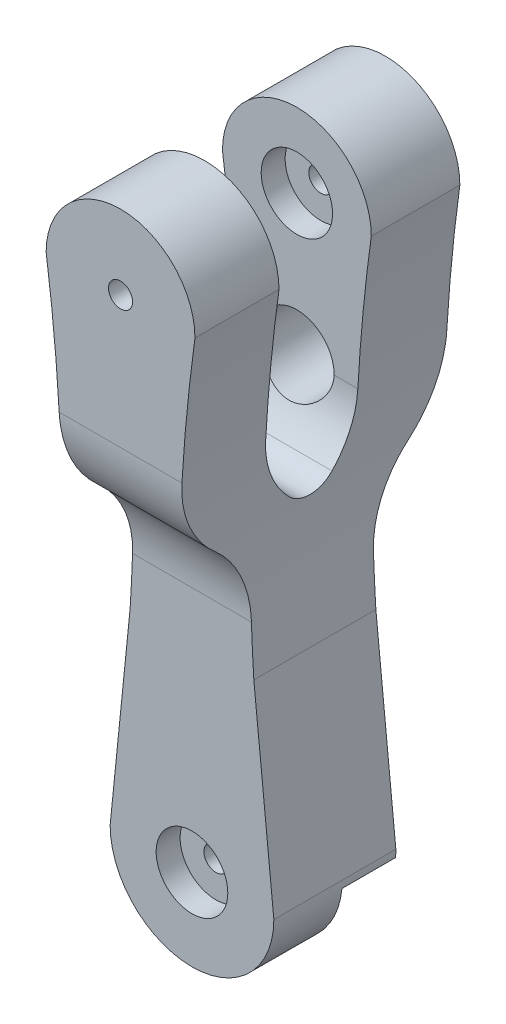
from build123d import *

# Parameters (mm, degrees)
SALIENTE_EXTRUIR1_DEPTH      = 44.5
SALIENTE_EXTRUIR1_DEPTH_BACK = 44.5
CORTAR_EXTRUIR1_START        = -24
CORTAR_EXTRUIR1_DEPTH        = 24
CORTAR_EXTRUIR2_DEPTH        = 24
REDONDEO1_R                  = 35
REDONDEO3_R                  = 35
CORTAR_EXTRUIR3_DEPTH        = 58.5
CROQUIS5_R                   = 12.500000000000016
CORTAR_EXTRUIR4_DEPTH        = 48.5
REDONDEO8_R                  = 30
REDONDEO9_R                  = 10
CORTAR_EXTRUIR5_DEPTH        = 43.05
CORTAR_EXTRUIR5_DEPTH_BACK   = 8.05
CROQUIS6_R                   = 12.000000000000016
CORTAR_EXTRUIR6_DEPTH        = 88.04999999999998
CORTAR_EXTRUIR6_DEPTH_BACK   = 28.049999999999997
CROQUIS7_R                   = 4.050000000000006
CROQUIS10_R                  = 27.5
CORTAR_EXTRUIR9_DEPTH        = 18
CORTAR_EXTRUIR14_DEPTH       = 35
CORTAR_EXTRUIR21_DEPTH       = 25
REDONDEO19_R                 = 3
CORTAR_EXTRUIR31_DEPTH       = 15
CORTAR_EXTRUIR31_DEPTH_BACK  = 4.999999999999999
CROQUIS33_R                  = 4.05
CORTAR_EXTRUIR32_DEPTH       = 35
CROQUIS34_R                  = 12.035
CORTAR_EXTRUIR33_DEPTH       = 8.05
CORTAR_EXTRUIR34_DEPTH       = 15
CORTAR_EXTRUIR34_DEPTH_BACK  = 5


with BuildPart() as part:
    # Croquis1 → Saliente-Extruir1 (new, two sides: drawn at the far end of the back side and taken through both)
    with BuildSketch(Plane.XY.offset(-SALIENTE_EXTRUIR1_DEPTH_BACK)):
        with BuildLine():
            Line((27.5, 0), (20.783701773198683, 66.38093729609668))
            ThreePointArc((20.783701773198683, 66.38093729609668), (20.024433339693815, 123.29687585851822), (25.000000000000014, 180))
            ThreePointArc((25.000000000000014, 180), (1.444e-14, 205), (-24.999999999999986, 180))
            ThreePointArc((-24.999999999999986, 180), (-20.0244333396937, 123.29687585851815), (-20.78370177319863, 66.38093729609668))
            Line((-20.78370177319863, 66.38093729609668), (-27.5, 0))
            ThreePointArc((-27.5, 0), (-5.05e-15, -27.5), (27.5, 0))
        make_face()
    extrude(amount=SALIENTE_EXTRUIR1_DEPTH + SALIENTE_EXTRUIR1_DEPTH_BACK)

    # Croquis2 → Cortar-Extruir1 (cut)
    with BuildSketch(Plane.XY.offset(44.5).offset(CORTAR_EXTRUIR1_START)):
        with BuildLine():
            Line((-27.5, -1.9203e-13), (-20.783701773198548, 66.3809372960967))
            ThreePointArc((-20.783701773198548, 66.3809372960967), (-19.923071613909883, 84.36144663092024), (-19.636097648887073, 102.36025342898752))
            Line((-19.636097648887073, 102.36025342898752), (19.636097648887297, 102.36025342898373))
            ThreePointArc((19.636097648887297, 102.36025342898373), (19.9230716139067, 84.36144663091831), (20.783701773198683, 66.38093729609668))
            Line((20.783701773198683, 66.38093729609668), (27.5, 0))
            ThreePointArc((27.5, 0), (9.938e-14, -27.499999999999986), (-27.5, -1.9203e-13))
        make_face()
    extrude(amount=CORTAR_EXTRUIR1_DEPTH, mode=Mode.SUBTRACT)

    # Croquis3 → Cortar-Extruir2 (cut)
    with BuildSketch(Plane(origin=(0, 0, -44.5), x_dir=(-1, 0, 0), z_dir=(0, 0, -1))):
        with BuildLine():
            Line((-27.5, 0), (-20.783701773198683, 66.38093729609668))
            ThreePointArc((-20.783701773198683, 66.38093729609668), (-19.923071613914544, 84.36144663091848), (-19.636097648887297, 102.36025342898373))
            Line((-19.636097648887297, 102.36025342898373), (19.636097648887073, 102.36025342898358))
            ThreePointArc((19.636097648887073, 102.36025342898358), (19.92307161390545, 84.36144663091817), (20.783701773198548, 66.3809372960967))
            Line((20.783701773198548, 66.3809372960967), (27.5, 0))
            ThreePointArc((27.5, 0), (1.68e-15, -27.499999999999996), (-27.5, 0))
        make_face()
    extrude(amount=-CORTAR_EXTRUIR2_DEPTH, mode=Mode.SUBTRACT)

    # Redondeo1
    # the kernel refuses this fillet: 35 mm, written as the material it takes off along each edge
    with BuildSketch(Plane(origin=(102.70233627806806, 102.36025342898402, -44.5), x_dir=(-3.62e-15, 1, 0), z_dir=(-1, -3.62e-15, 0))) as redondeo1_piece_1:
        with BuildLine():
            CenterArc((33.22649545167231, -35), REDONDEO1_R, 90, 71.68230158880155)
            Line((1.421e-14, -24), (-0.6645299090334333, -23.78))
            ThreePointArc((-0.6645299090334333, -23.78), (-0.7000000000000028, -12), (-0.7000000000000028, 0))
            Line((-0.7000000000000028, 0), (0, 0.7000000000000028))
            Line((0, 0.7000000000000028), (33.22649545167231, 0.7000000000000028))
            Line((33.22649545167231, 0.7000000000000028), (33.22649545167231, 0))
        make_face()
    extrude(amount=205.4046725561359, mode=Mode.SUBTRACT)
    with BuildSketch(Plane(origin=(-102.7023362780678, 102.36025342899555, 44.5), x_dir=(0, 0, -1), z_dir=(1, -9.662e-14, 0))) as redondeo1_piece_2:
        with BuildLine():
            CenterArc((35, 33.22649545167229), REDONDEO1_R, 180, 71.68230158880152)
            Line((0, 33.22649545167229), (-0.7000000000000028, 33.22649545167229))
            Line((-0.7000000000000028, 33.22649545167229), (-0.7000000000000028, 0))
            Line((-0.7000000000000028, 0), (0, -0.7000000000000028))
            ThreePointArc((0, -0.7000000000000028), (12, -0.7000000000000028), (23.78, -0.6645299090334476))
            Line((23.78, -0.6645299090334476), (24, 0))
        make_face()
    extrude(amount=205.40467255613584, mode=Mode.SUBTRACT)

    # Redondeo3
    redondeo3_edges = [part.edges().sort_by_distance(p)[0] for p in [
        (1.1369e-13, 102.36025342898563, 20.5),
        (1.1013e-13, 102.36025342898365, -20.5),
    ]]
    fillet(redondeo3_edges, radius=REDONDEO3_R)

    # Croquis3D2 → Cortar-Extruir3 (cut)
    with BuildSketch(Plane(origin=(-24.999999999999105, 121.83181469642778, -14.739893982780725), x_dir=(-2.150015976069332e-12, 0.970486714162273, 0.24115459281240073), z_dir=(-1.0, 0, -8.914949664428034e-12))):
        with BuildLine():
            Line((0, 0), (121.09710255773136, 30.091213029412213))
            Line((121.09710255773136, 30.091213029412213), (128.5573844091173, -3.47e-15))
            Line((128.5573844091173, -3.47e-15), (7.6467007003513885, -30.044890126730003))
            ThreePointArc((7.6467007003513885, -30.044890126730003), (-2.3764738724496546, -25.575940038707603), (-10.455030098348384, -18.148122545589356))
            ThreePointArc((-10.455030098348384, -18.148122545589356), (-6.687251525667822, -8.233115397591352), (0, 0))
        make_face()
    extrude(amount=-CORTAR_EXTRUIR3_DEPTH, mode=Mode.SUBTRACT)

    # Croquis5 → Cortar-Extruir4 (cut)
    with BuildSketch(Plane(origin=(0, 0, -44.5), x_dir=(-1, 0, 0), z_dir=(0, 0, -1))):
        with Locations(Location((-1.01308e-12, 133.57263188887632, 0), (0, 0, 9.272454345))):
            Circle(CROQUIS5_R)
    extrude(amount=-CORTAR_EXTRUIR4_DEPTH, mode=Mode.SUBTRACT)

    # Redondeo8
    # the kernel refuses this fillet: 30 mm, written as the material it adds along each edge
    with BuildSketch(Plane(origin=(-74.1309499335336, 122.00737288868928, 16.26230970698953), x_dir=(-1.4e-16, 1, -2.41e-15), z_dir=(1.0, 0, 8.914949664428034e-12))) as redondeo8_piece_1_section:
        with BuildLine():
            CenterArc((11.78730191984913, -30), REDONDEO8_R, 90.00000000000004, 61.98943792286214)
            Line((-14.698529101666413, -15.910970398933602), (-15.228245722096721, -15.629189806912274))
            ThreePointArc((-15.228245722096721, -15.629189806912274), (-9.090373471764734, -6.34705155262911), (-0.288148981094737, 0.5262795499485684))
            Line((-0.288148981094737, 0.5262795499485684), (-1.45e-15, 0.6000000000000014))
            Line((-1.45e-15, 0.6000000000000014), (11.787301919849112, 0.6000000000000014))
            Line((11.787301919849112, 0.6000000000000014), (11.787301919849114, 0))
        make_face()
    redondeo8_piece_1 = extrude(amount=148.26189986706723, mode=Mode.PRIVATE)
    redondeo8_piece_1 = redondeo8_piece_1 - Plane(origin=(-584.2158848617112, 102.36025342898773, 12.086878930976017), x_dir=(0.9904993014758943, 0.13751775803788244, 0), z_dir=(0, 0, -1)) * Cylinder(564.579787212824, 361, mode=Mode.PRIVATE)
    redondeo8_piece_1 = redondeo8_piece_1 - Plane(origin=(584.2158848617221, 102.36025342898745, 12.086878930976017), x_dir=(-0.9979673304813536, -0.06372760227657126, 0), z_dir=(0, 0, -1)) * Cylinder(564.5797872128348, 361, mode=Mode.PRIVATE)
    add(redondeo8_piece_1)
    with BuildSketch(Plane(origin=(-72.33261967734306, 121.83181469642777, -14.739893983202698), x_dir=(-6.42350550029948e-12, -0.6934105693594783, 0.7205426998454458), z_dir=(1.0, 0, 8.914949664428034e-12))) as redondeo8_piece_2_section:
        with BuildLine():
            CenterArc((13.634950866610524, -29.095944858396155), REDONDEO8_R, 75.89830986699852, 60.20099506763049)
            Line((-7.9813301287528535, -8.293627777611805), (-8.413655748660121, -7.8775814359961185))
            Line((-8.413655748660121, -7.8775814359961185), (-0.43232561990726726, 0.41604634161568677))
            Line((-0.43232561990726726, 0.41604634161568677), (-0.18817326017112648, 0.5697287285687529))
            ThreePointArc((-0.18817326017112648, 0.5697287285687529), (10.47212975338705, 2.2846425572884943), (21.090445679577403, 0.581918897167919))
            Line((21.090445679577403, 0.581918897167919), (20.944259506774134, -3.7e-16))
        make_face()
    redondeo8_piece_2 = extrude(amount=120.40337198241693, mode=Mode.PRIVATE)
    redondeo8_piece_2 = redondeo8_piece_2 - Plane(origin=(-584.2158848617112, 102.36025342898773, -10.345911675917899), x_dir=(0.9904993014758943, 0.13751775803788244, 0), z_dir=(0, 0, -1)) * Cylinder(564.579787212824, 326, mode=Mode.PRIVATE)
    redondeo8_piece_2 = redondeo8_piece_2 - Plane(origin=(1.01308e-12, 133.57263188887632, -10.345911675917897), x_dir=(-0.9869332953933623, 0.16112935934831482, 0), z_dir=(0, 0, -1)) * Cylinder(12.500000000000016, 326, mode=Mode.PRIVATE)
    redondeo8_piece_2 = redondeo8_piece_2 - Plane(origin=(584.2158848617221, 102.36025342898745, -10.345911675917899), x_dir=(-0.9979673304813536, -0.06372760227657126, 0), z_dir=(0, 0, -1)) * Cylinder(564.5797872128348, 326, mode=Mode.PRIVATE)
    add(redondeo8_piece_2)
    with BuildSketch(Plane(origin=(-48.07075230507185, 121.83181469642778, -14.739893982986406), x_dir=(-6.423505500299477e-12, -0.6934105693594786, 0.7205426998454454), z_dir=(1.0, 0, 8.914949664428034e-12))) as redondeo8_piece_3_section:
        with BuildLine():
            CenterArc((13.634950866610517, -29.095944858396148), REDONDEO8_R, 75.89830986699847, 60.2009950676305)
            Line((-7.9813301287528455, -8.29362777761179), (-8.413655748660112, -7.877581435996103))
            Line((-8.413655748660112, -7.877581435996103), (-0.432325619907267, 0.41604634161568693))
            Line((-0.432325619907267, 0.41604634161568693), (-0.18817326017112612, 0.569728728568753))
            ThreePointArc((-0.18817326017112612, 0.569728728568753), (10.472129753387057, 2.284642557288501), (21.090445679577414, 0.5819188971679177))
            Line((21.090445679577414, 0.5819188971679177), (20.944259506774145, -1.85e-15))
        make_face()
    redondeo8_piece_3 = extrude(amount=120.40337198241494, mode=Mode.PRIVATE)
    redondeo8_piece_3 = redondeo8_piece_3 - Plane(origin=(-584.2158848617112, 102.36025342898773, -10.345911675910257), x_dir=(0.9904993014758943, 0.13751775803788244, 0), z_dir=(0, 0, -1)) * Cylinder(564.579787212824, 326, mode=Mode.PRIVATE)
    redondeo8_piece_3 = redondeo8_piece_3 - Plane(origin=(1.01308e-12, 133.57263188887632, -10.345911675910259), x_dir=(-0.9869332953933623, 0.16112935934831482, 0), z_dir=(0, 0, -1)) * Cylinder(12.500000000000016, 326, mode=Mode.PRIVATE)
    redondeo8_piece_3 = redondeo8_piece_3 - Plane(origin=(584.2158848617221, 102.36025342898745, -10.345911675910257), x_dir=(-0.9979673304813536, -0.06372760227657126, 0), z_dir=(0, 0, -1)) * Cylinder(564.5797872128348, 326, mode=Mode.PRIVATE)
    add(redondeo8_piece_3)

    # Redondeo9
    redondeo9_edges = [part.edges().sort_by_distance(p)[0] for p in [
        (1.066e-14, 107.30884378702285, 0.3513393087168235),
    ]]
    fillet(redondeo9_edges, radius=REDONDEO9_R)

    # Croquis6 → Cortar-Extruir5 (cut, two sides: drawn at the far end of the back side and taken through both)
    with BuildSketch(Plane.XY.offset(-14.73989398278073).offset(-CORTAR_EXTRUIR5_DEPTH_BACK)):
        with Locations(Location((1.01308e-12, 180, 0), (0, 0, 180))):
            Circle(CROQUIS6_R)
    extrude(amount=CORTAR_EXTRUIR5_DEPTH + CORTAR_EXTRUIR5_DEPTH_BACK, mode=Mode.SUBTRACT)

    # Croquis7 → Cortar-Extruir6 (cut, two sides: drawn at the far end of the back side and taken through both)
    with BuildSketch(Plane.XY.offset(-22.78989398278073).offset(-CORTAR_EXTRUIR6_DEPTH_BACK)):
        with Locations((1.01308e-12, 180)):
            Circle(CROQUIS7_R)
    extrude(amount=CORTAR_EXTRUIR6_DEPTH + CORTAR_EXTRUIR6_DEPTH_BACK, mode=Mode.SUBTRACT)

    # Croquis10 → Cortar-Extruir9 (cut)
    with BuildSketch(Plane(origin=(0, 0, -20.499999999999996), x_dir=(-1, 0, 0), z_dir=(0, 0, -1))):
        with Locations((0, -5.041436867208791)):
            Circle(CROQUIS10_R)
    extrude(amount=-CORTAR_EXTRUIR9_DEPTH, mode=Mode.SUBTRACT)

    # Croquis12 → Cortar-Extruir14 (cut)
    with BuildSketch(Plane(origin=(25.000000000000135, 179.99999999999997, -44.5), x_dir=(1, 0, 0), z_dir=(0, 0, 1))):
        Polygon((-20.000000000000146, -95.04143686720876), (-30.000000000000146, -95.04143686720876), (-30.00000000000014, -164.05714355557723), (-20.000000000000135, -164.05714355557723), align=None)
    extrude(amount=CORTAR_EXTRUIR14_DEPTH, mode=Mode.SUBTRACT)

    # Croquis20 → Cortar-Extruir21 (cut)
    with BuildSketch(Plane(origin=(0, 0, -44.5), x_dir=(-1, 0, 0), z_dir=(0, 0, -1))):
        Polygon((-9.999999999999998, 39.456606796679445), (-6.999999999999997, 39.456606796679445), (-6.999999999999997, 29.45660679667944), (-9.999999999999996, 29.45660679667944), align=None)
        Polygon((7.000000000000003, 39.456606796679445), (7.000000000000004, 29.45660679667944), (10.000000000000004, 29.45660679667944), (10.000000000000004, 39.456606796679445), align=None)
        Polygon((-10.000000000000068, 59.45660679667944), (-10.000000000000066, 49.456606796679445), (-7.000000000000066, 49.456606796679445), (-7.000000000000066, 59.45660679667944), align=None)
        Polygon((6.999999999999934, 59.45660679667944), (6.999999999999936, 49.456606796679445), (9.999999999999934, 49.456606796679445), (9.999999999999934, 59.45660679667944), align=None)
        Polygon((-10.000000000000135, 79.45660679667944), (-10.000000000000133, 69.45660679667945), (-7.000000000000135, 69.45660679667945), (-7.000000000000135, 79.45660679667944), align=None)
        Polygon((6.999999999999866, 79.45660679667944), (6.999999999999868, 69.45660679667945), (9.999999999999867, 69.45660679667945), (9.999999999999867, 79.45660679667944), align=None)
    extrude(amount=-CORTAR_EXTRUIR21_DEPTH, mode=Mode.SUBTRACT)

    # Redondeo19
    redondeo19_edges = [part.edges().sort_by_distance(p)[0] for p in [
        (-1.066e-14, 84.95856313279121, -9.5),
    ]]
    fillet(redondeo19_edges, radius=REDONDEO19_R)

    # Croquis32 → Cortar-Extruir31 (cut, two sides: drawn at the far end of the back side and taken through both)
    with BuildSketch(Plane.ZY.offset(-5).offset(-CORTAR_EXTRUIR31_DEPTH_BACK)):
        Polygon((-18.499999999999996, 39.456606796679445), (-15.499999999999995, 39.456606796679445), (-15.499999999999993, 29.45660679667944), (-18.499999999999993, 29.45660679667944), align=None)
        Polygon((-18.500000000000064, 59.45660679667944), (-18.50000000000006, 49.456606796679445), (-15.500000000000062, 49.456606796679445), (-15.500000000000064, 59.45660679667944), align=None)
        Polygon((-18.500000000000135, 79.45660679667944), (-18.50000000000013, 69.45660679667945), (-15.50000000000013, 69.45660679667945), (-15.500000000000131, 79.45660679667944), align=None)
    extrude(amount=CORTAR_EXTRUIR31_DEPTH + CORTAR_EXTRUIR31_DEPTH_BACK, mode=Mode.SUBTRACT)

    # Croquis33 → Cortar-Extruir32 (cut)
    with BuildSketch(Plane(origin=(0, 0, -2.4999999999999987), x_dir=(-1, 0, 0), z_dir=(0, 0, -1))):
        Circle(CROQUIS33_R)
    extrude(amount=-CORTAR_EXTRUIR32_DEPTH, mode=Mode.SUBTRACT)

    # Croquis34 → Cortar-Extruir33 (cut)
    with BuildSketch(Plane.XY.offset(20.499999999999996)):
        Circle(CROQUIS34_R)
    extrude(amount=-CORTAR_EXTRUIR33_DEPTH, mode=Mode.SUBTRACT)

    # Croquis37 → Cortar-Extruir34 (cut, two sides: drawn at the far end of the back side and taken through both)
    with BuildSketch(Plane.ZY.offset(-5).offset(-CORTAR_EXTRUIR34_DEPTH_BACK)):
        with BuildLine():
            Line((-22.632725635901352, 97.43749906982208), (-19.632725635901352, 97.43749906982207))
            ThreePointArc((-19.632725635901352, 97.43749906982207), (-17.78687637341474, 92.5933956839005), (-17.249077881176206, 87.4374990698221))
            Line((-17.249077881176206, 87.4374990698221), (-20.249077881176206, 87.4374990698221))
            ThreePointArc((-20.249077881176206, 87.4374990698221), (-20.76000516185466, 92.5998008342107), (-22.632725635901352, 97.43749906982208))
        make_face()
    extrude(amount=CORTAR_EXTRUIR34_DEPTH + CORTAR_EXTRUIR34_DEPTH_BACK, mode=Mode.SUBTRACT)


solid = part.part
